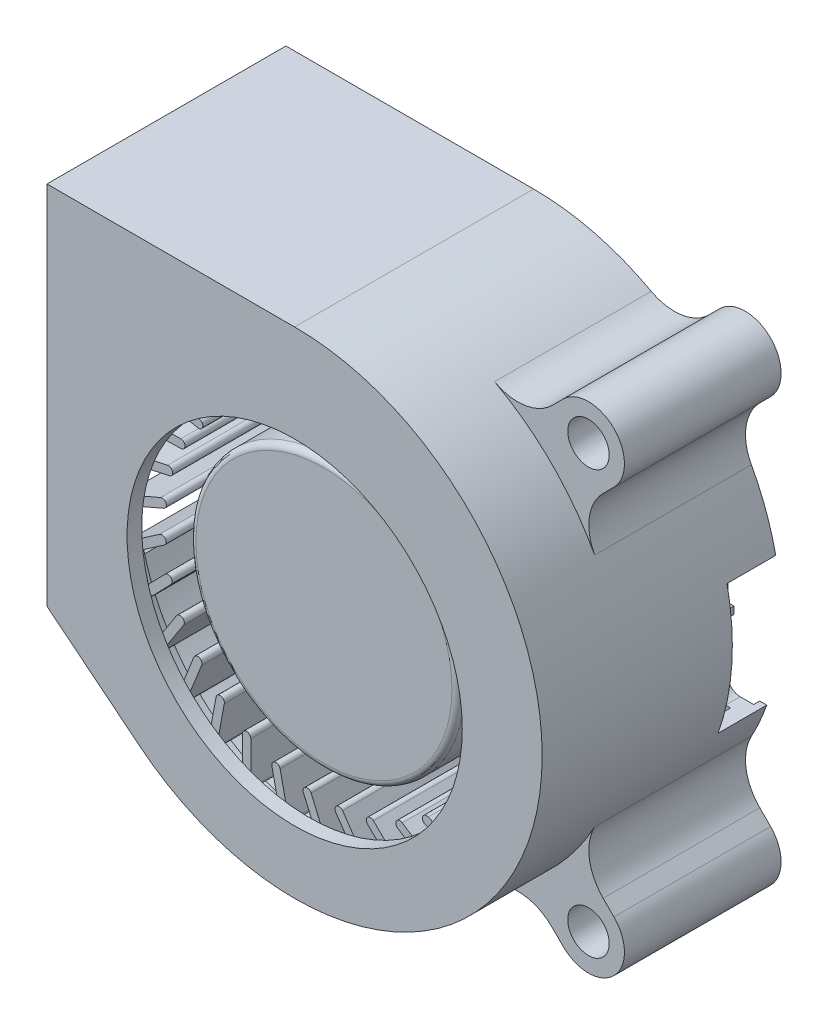
from build123d import *

# Parameters (mm, degrees)
SKETCH_1_R               = 1.7
EXTRUDE_1_DEPTH          = 12.85
EXTRUDE_1_2_DEPTH        = 12.85
EXTRUDE_1_3_DEPTH        = 12.85
SKETCH_1_4_R             = 13.747729201
EXTRUDE_2_DEPTH          = 1.7
EXTRUDE_3_DEPTH          = 19.6
EXTRUDE_START            = 18.4
SKETCH_1_6_R             = 13.747729201
EXTRUDE_4_DEPTH          = 1.2
SKETCH_2_R               = 9.8
CUT_EXTRUDE_1_DEPTH      = 0.5
SKETCH_3_W               = 9.256703166
SKETCH_3_H               = 11
CUT_EXTRUDE_2_DEPTH      = 4
CUT_EXTRUDE_3_DEPTH      = 2
EXTRUDE_5_REACH          = 46.392
EXTRUDE_5_END_RADIUS     = 19.1
FILLET_1_R               = 4
FILLET_2_R               = 1
SKETCH_6_R               = 16.447521627
SKETCH_6_R_2             = 11
EXTRUDE_6_DEPTH          = 1.2
EXTRUDE_7_DEPTH          = 13
PATTERN_CIRCULAR_6_COUNT = 32
EXTRUDE_START_2          = 13
EXTRUDE_8_DEPTH          = 1.2
SKETCH_6_5_R             = 11
EXTRUDE_9_DEPTH          = 13
FILLET_3_R               = 0.5


with BuildPart() as part:
    # Эскиз1 → Бобышка-Вытянуть1 (new body)
    with BuildSketch(Plane.XY):
        with BuildLine():
            Line((15.264034995, 20.838235803), (12.115927475, 17.690128283))
            ThreePointArc((12.115927475, 17.690128283), (14.354267658, 15.756538457), (16.287857484, 13.518198274))
            Line((16.287857484, 13.518198274), (19.435965005, 16.666305794))
            ThreePointArc((19.435965005, 16.666305794), (19.435965005, 20.838235803), (15.264034995, 20.838235803))
        make_face()
        with Locations(Location((17.35, 18.752270799, 0), (0, 0, 180))):
            Circle(SKETCH_1_R, mode=Mode.SUBTRACT)
    extrude(amount=EXTRUDE_1_DEPTH)



with BuildPart() as body_2:
    # Эскиз1 → Extrude 1 2 (new body)
    with BuildSketch(Plane.XY):
        with BuildLine():
            Line((19.435965005, -13.861764197), (16.287857484, -10.713656676))
            ThreePointArc((16.287857484, -10.713656676), (14.354267658, -12.951996859), (12.115927475, -14.885586685))
            Line((12.115927475, -14.885586685), (15.264034995, -18.033694206))
            ThreePointArc((15.264034995, -18.033694206), (16.221083875, -18.673173822), (17.35, -18.897729201))
            ThreePointArc((17.35, -18.897729201), (20.075444621, -17.076645327), (19.435965005, -13.861764197))
        make_face()
        with Locations(Location((17.35, -15.947729201, 0), (0, 0, 180))):
            Circle(SKETCH_1_R, mode=Mode.SUBTRACT)
    extrude(amount=EXTRUDE_1_2_DEPTH)


with BuildPart() as body_3:
    # Эскиз1 → Extrude 1 3 (new body)
    with BuildSketch(Plane.XY):
        with BuildLine():
            Line((-12.733507609, -14.4074662), (-16.748170111, -11.173969304))
            Line((-16.748170111, -11.173969304), (-19.435965005, -13.861764197))
            ThreePointArc((-19.435965005, -13.861764197), (-19.435965005, -18.033694206), (-15.264034995, -18.033694206))
            Line((-15.264034995, -18.033694206), (-12.115927475, -14.885586685))
            ThreePointArc((-12.115927475, -14.885586685), (-12.427017172, -14.649496836), (-12.733507609, -14.4074662))
        make_face()
        with Locations(Location((-17.35, -15.947729201, 0), (0, 0, 180))):
            Circle(SKETCH_1_R, mode=Mode.SUBTRACT)
    extrude(amount=EXTRUDE_1_3_DEPTH)


with BuildPart() as body_4:
    # Эскиз1<4> → Бобышка-Вытянуть2 (new body)
    # profile 1 of 2: a face of its own
    with BuildSketch(Plane.XY):
        with BuildLine():
            Line((0.10524456, 20.501980838), (-20.319267798, 20.502270799))
            Line((-20.319267798, 20.502270799), (-20.319267798, -7.010187059))
            Line((-20.319267798, -7.010187059), (-17.647345009, -5.903974075))
            ThreePointArc((-17.647345009, -5.903974075), (15.850865457, -9.25418566), (0.10524456, 20.501980838))
        make_face()
        Circle(SKETCH_1_4_R, mode=Mode.SUBTRACT)
    # profile 2 of 2: a face of its own
    with BuildSketch(Plane.XY):
        Circle(SKETCH_1_4_R)
    extrude(amount=EXTRUDE_2_DEPTH)


with BuildPart() as part_1:
    add(part.part)

    add(body_2.part)  # Бобышка-Вытянуть3 merges body 2

    add(body_3.part)  # Бобышка-Вытянуть3 merges body 3

    add(body_4.part)  # Бобышка-Вытянуть3 merges body 4
    # Эскиз1<5> → Бобышка-Вытянуть3 (add)
    with BuildSketch(Plane.XY):
        with BuildLine():
            Line((0, 21.702270799), (-20.319267798, 21.702270799))
            Line((-20.319267798, 21.702270799), (-20.319267798, 20.502270799))
            Line((-20.319267798, 20.502270799), (0.10524456, 20.501980838))
            ThreePointArc((0.10524456, 20.501980838), (15.850865457, -9.25418566), (-17.647345009, -5.903974075))
            Line((-17.647345009, -5.903974075), (-20.319267798, -7.010187059))
            Line((-20.319267798, -7.010187059), (-20.319267798, -8.297729201))
            Line((-20.319267798, -8.297729201), (-16.748170111, -11.173969304))
            Line((-16.748170111, -11.173969304), (-12.733507609, -14.4074662))
            ThreePointArc((-12.733507609, -14.4074662), (-12.427017172, -14.649496836), (-12.115927475, -14.885586685))
            ThreePointArc((-12.115927475, -14.885586685), (-6.38147683, -17.868607579), (0, -18.897729201))
            ThreePointArc((0, -18.897729201), (6.38147683, -17.868607579), (12.115927475, -14.885586685))
            ThreePointArc((12.115927475, -14.885586685), (14.354267658, -12.951996859), (16.287857484, -10.713656676))
            ThreePointArc((16.287857484, -10.713656676), (20.3, 1.402270799), (16.287857484, 13.518198274))
            ThreePointArc((16.287857484, 13.518198274), (14.354267658, 15.756538457), (12.115927475, 17.690128283))
            ThreePointArc((12.115927475, 17.690128283), (6.38147683, 20.673149177), (0, 21.702270799))
        make_face()
    extrude(amount=EXTRUDE_3_DEPTH)

    # Эскиз1<6> → Бобышка-Вытянуть4 (add)
    with BuildSketch(Plane.XY.offset(EXTRUDE_START)):
        with BuildLine():
            Line((0.10524456, 20.501980838), (-20.319267798, 20.502270799))
            Line((-20.319267798, 20.502270799), (-20.319267798, -7.010187059))
            Line((-20.319267798, -7.010187059), (-17.647345009, -5.903974075))
            ThreePointArc((-17.647345009, -5.903974075), (15.850865457, -9.25418566), (0.10524456, 20.501980838))
        make_face()
        Circle(SKETCH_1_6_R, mode=Mode.SUBTRACT)
    extrude(amount=EXTRUDE_4_DEPTH)

    # Эскиз2 → Вырез-Вытянуть1 (cut)
    with BuildSketch(Plane(origin=(0, 0, 0), x_dir=(-1, 0, 0), z_dir=(0, 0, -1))):
        Circle(SKETCH_2_R)
        with BuildLine():
            Line((-10.395672176, -0.3), (-19.680703129, -0.3))
            ThreePointArc((-19.680703129, -0.3), (-13.463447565, -13.053294952), (-0.301010904, -18.349620097))
            Line((-0.301010904, -18.349620097), (-0.3, -10.395672176))
            ThreePointArc((-0.3, -10.395672176), (-7.353910524, -7.353910524), (-10.395672176, -0.3))
        make_face()
        with BuildLine():
            Line((-0.3, 10.395672176), (-0.286878861, 21.154372004))
            ThreePointArc((-0.286878861, 21.154372004), (-14.450920292, 14.870704421), (-19.723407429, 0.3))
            Line((-19.723407429, 0.3), (-10.395672176, 0.3))
            ThreePointArc((-10.395672176, 0.3), (-7.353910524, 7.353910524), (-0.3, 10.395672176))
        make_face()
        with BuildLine():
            Line((10.395672176, 0.3), (19.876597711, 0.3))
            Line((19.876597711, 0.3), (19.850482249, 21.154372004))
            Line((19.850482249, 21.154372004), (0.300064789, 21.154372004))
            Line((0.300064789, 21.154372004), (0.3, 10.395672176))
            ThreePointArc((0.3, 10.395672176), (7.353910524, 7.353910524), (10.395672176, 0.3))
        make_face()
        with BuildLine():
            Line((0.3, -10.395672176), (0.301010904, -18.349620097))
            ThreePointArc((0.301010904, -18.349620097), (6.711074478, -17.176999394), (12.390849847, -13.982612743))
            Line((12.390849847, -13.982612743), (19.887022297, -8.024501371))
            Line((19.887022297, -8.024501371), (19.877349077, -0.3))
            Line((19.877349077, -0.3), (10.395672176, -0.3))
            ThreePointArc((10.395672176, -0.3), (7.353910524, -7.353910524), (0.3, -10.395672176))
        make_face()
    extrude(amount=-CUT_EXTRUDE_1_DEPTH, mode=Mode.SUBTRACT)

    # Эскиз3 → Вырез-Вытянуть2 (cut)
    with BuildSketch(Plane(origin=(0, 0, 0), x_dir=(-1, 0, 0), z_dir=(0, 0, -1))):
        with Locations((-21.059184672, 0.107349395)):
            Rectangle(SKETCH_3_W, SKETCH_3_H)
    extrude(amount=-CUT_EXTRUDE_2_DEPTH, mode=Mode.SUBTRACT)

    # Эскиз4 → Вырез-Вытянуть3 (cut)
    with BuildSketch(Plane(origin=(0, 0, 0), x_dir=(-1, 0, 0), z_dir=(0, 0, -1))):
        with BuildLine():
            Line((1.85, -12.555668095), (3.757252597, -12.555668095))
            Line((3.757252597, -12.555668095), (3.757252597, -9.052785987))
            ThreePointArc((3.757252597, -9.052785987), (-0.008834156, -9.801520452), (-3.773565115, -9.045998426))
            Line((-3.773565115, -9.045998426), (-3.773565115, -12.555668095))
            Line((-3.773565115, -12.555668095), (-1.85, -12.555668095))
            Line((-1.85, -12.555668095), (-1.85, -18.98767832))
            Line((-1.85, -18.98767832), (1.85, -18.98767832))
            Line((1.85, -18.98767832), (1.85, -12.555668095))
        make_face()
    extrude(amount=-CUT_EXTRUDE_3_DEPTH, mode=Mode.SUBTRACT)

    # Бобышка-Вытянуть5: up to this cylinder (the profile starts inside it)
    extrude_5_end = Plane(origin=(0, 1.402270799, 2.541069), z_dir=(0, 0, -1)) * Cylinder(EXTRUDE_5_END_RADIUS, 131.984, mode=Mode.PRIVATE)
    # Эскиз5 → Бобышка-Вытянуть5 (add, up to the surface)
    with BuildSketch(Plane(origin=(0, -12.555668095, 0), x_dir=(1, 0, 0), z_dir=(0, 1, 0)), mode=Mode.PRIVATE) as extrude_5_sk1:
        Polygon((1.85, -1.7), (1.85, -2), (-1.85, -2), (-1.85, -1.7), (-2.803626299, -1.7), (-2.803626299, -3.2), (2.811782558, -3.2), (2.811782558, -1.7), align=None)
    extrude_5_tool1 = extrude(extrude_5_sk1.sketch, amount=-EXTRUDE_5_REACH, mode=Mode.PRIVATE) & extrude_5_end
    add(extrude_5_tool1.solids().sort_by_distance((0.004697, -12.555668, 2.541069))[0])

    # Скругление1
    # the kernel refuses this fillet: 4 mm, written as the material it adds along each edge
    with BuildSketch(Plane(origin=(16.287857484, 13.518198274, 0), x_dir=(0.5374839901156817, -0.8432739533326793, 0), z_dir=(0, 0, 1)), Plane(origin=(12.115927475, -14.885586685, 0), x_dir=(-0.843273953332668, -0.5374839901156996, 0), z_dir=(0, 0, 1))) as fillet_1_piece_1:
        with BuildLine():
            CenterArc((3.213360638, 3.989604535), FILLET_1_R, 192.487473156, 73.380875213)
            Line((-0.692012582, 3.124699909), (0, 0))
            ThreePointArc((0, 0), (1.462583429, 0.052756985), (2.925166858, 0))
        make_face()
    extrude(amount=12.85)
    with BuildSketch(Plane(origin=(12.115927475, 17.690128283, 0), x_dir=(-0.8432739533326813, 0.5374839901156786, 0), z_dir=(0, 0, 1)), Plane(origin=(-12.115927475, -14.885586685, 0), x_dir=(0.8432739533326661, -0.5374839901157026, 0), z_dir=(0, 0, 1)), Plane(origin=(16.287857484, -10.713656676, 0), x_dir=(0.5374839901156938, 0.8432739533326716, 0), z_dir=(0, 0, 1))) as fillet_1_piece_2:
        with BuildLine():
            CenterArc((3.213360638, -3.989604535), FILLET_1_R, 94.131651631, 73.380875213)
            Line((-0.692012582, -3.124699909), (0, 0))
            ThreePointArc((0, 0), (1.462583429, -0.052756985), (2.925166858, 0))
        make_face()
    extrude(amount=12.85)
    with BuildSketch(Plane(origin=(-16.748170111, -11.173969304, 0), x_dir=(-0.7048615902464511, -0.7093448657706942, 0), z_dir=(0, 0, 1))) as fillet_1_piece_3:
        with BuildLine():
            CenterArc((4.438372775, -3.983640748), FILLET_1_R, 95.183671694, 90.785963447)
            Line((0.460064166, -4.399646288), (0.062233305, -4.441246842))
            Line((0.062233305, -4.441246842), (-0.397830861, -0.041600554))
            Line((-0.397830861, -0.041600554), (0.001268062, 0.39999799))
            ThreePointArc((0.001268062, 0.39999799), (3.802364952, 0.387947865), (4.040838201, 0.398364075))
            Line((4.040838201, 0.398364075), (4.076977708, 0))
        make_face()
    extrude(amount=12.85)

    # Скругление2
    fillet_2_edges = [part_1.edges().sort_by_distance(p)[0] for p in [
        (10.395672176, -0.3, 0.25),
        (0.3, 10.395672176, 0.25),
        (10.395672176, 0.3, 0.25),
        (0.286878861, 21.154372004, 0.25),
        (-10.395672176, -0.3, 0.25),
        (-19.877349077, -0.3, 0.25),
        (-19.887022297, -8.024501371, 0.25),
        (16.430833089, -5.392650605, 1.1),
        (16.430833089, 5.607349395, 1.1),
        (-10.395672176, 0.3, 0.25),
        (-0.3, 10.395672176, 0.25),
        (-0.300064789, 21.154372004, 0.25),
        (-19.850482249, 21.154372004, 0.25),
        (-19.876597711, 0.3, 0.25),
    ]]
    fillet(fillet_2_edges, radius=FILLET_2_R)


with BuildPart() as body_2_2:
    # Эскиз6 → Бобышка-Вытянуть6 (new body)
    with BuildSketch(Plane.XY.offset(4.2)):
        Circle(SKETCH_6_R)
        Circle(SKETCH_6_R_2, mode=Mode.SUBTRACT)
    extrude(amount=EXTRUDE_6_DEPTH)

    # Эскиз6<3> → Бобышка-Вытянуть7 (add)
    with BuildSketch(Plane.XY.offset(4.2)):
        with BuildLine():
            Line((-13.408117655, 1.68407996), (-16.44321372, 0.376417621))
            ThreePointArc((-16.44321372, 0.376417621), (-16.447513623, 0.016225937), (-16.443924406, -0.34397353))
            ThreePointArc((-16.443924406, -0.34397353), (-16.376272283, -0.336532704), (-16.311409287, -0.315917965))
            Line((-16.311409287, -0.315917965), (-13.135892976, 1.05224403))
            ThreePointArc((-13.135892976, 1.05224403), (-12.95608735, 1.504274335), (-13.408117655, 1.68407996))
        make_face()
    extrude_7 = extrude(amount=EXTRUDE_7_DEPTH)

    # Круговой массив6: Бобышка-Вытянуть7 ×32 about axis
    pattern_circular_6_axis = Axis((0, 0, 0), (0, 0, 1))
    for i in range(1, PATTERN_CIRCULAR_6_COUNT):
        add(extrude_7.rotate(pattern_circular_6_axis, i * 360 / PATTERN_CIRCULAR_6_COUNT))

    # Эскиз6<4> → Бобышка-Вытянуть8 (add)
    with BuildSketch(Plane.XY.offset(4.2).offset(EXTRUDE_START_2)):
        with BuildLine():
            ThreePointArc((-16.772842013, 0.111791663), (-16.699805052, 0.233845681), (-16.583633966, 0.315917965))
            Line((-16.583633966, 0.315917965), (-16.44321372, 0.376417621))
            ThreePointArc((-16.44321372, 0.376417621), (0.188221135, 16.446444615), (16.447521627, 0))
            ThreePointArc((16.447521627, 0), (0.17199617, -16.446622297), (-16.443924406, -0.34397353))
            ThreePointArc((-16.443924406, -0.34397353), (-16.645898928, -0.281028781), (-16.772842013, -0.111791663))
            ThreePointArc((-16.772842013, -0.111791663), (0.055896142, -16.77312142), (16.773214557, 0))
            ThreePointArc((16.773214557, 0), (0.055896142, 16.77312142), (-16.772842013, 0.111791663))
        make_face()
        with BuildLine():
            Line((-16.44321372, 0.376417621), (-16.583633966, 0.315917965))
            ThreePointArc((-16.583633966, 0.315917965), (-16.699805052, 0.233845681), (-16.772842013, 0.111791663))
            ThreePointArc((-16.772842013, 0.111791663), (-16.773214557, 0), (-16.772842013, -0.111791663))
            ThreePointArc((-16.772842013, -0.111791663), (-16.645898928, -0.281028781), (-16.443924406, -0.34397353))
            ThreePointArc((-16.443924406, -0.34397353), (-16.447513623, 0.016225937), (-16.44321372, 0.376417621))
        make_face()
    extrude(amount=-EXTRUDE_8_DEPTH)

    # Эскиз6<5> → Бобышка-Вытянуть9 (add)
    with BuildSketch(Plane.XY.offset(4.2)):
        with Locations(Location((0, 0, 0), (0, 0, 180))):
            Circle(SKETCH_6_5_R)
    extrude(amount=EXTRUDE_9_DEPTH)

    # Скругление3
    fillet_3_edges = [body_2_2.edges().sort_by_distance(p)[0] for p in [
        (11, 0, 17.2),
    ]]
    fillet(fillet_3_edges, radius=FILLET_3_R)


solid = Compound([part_1.part, body_2_2.part])
